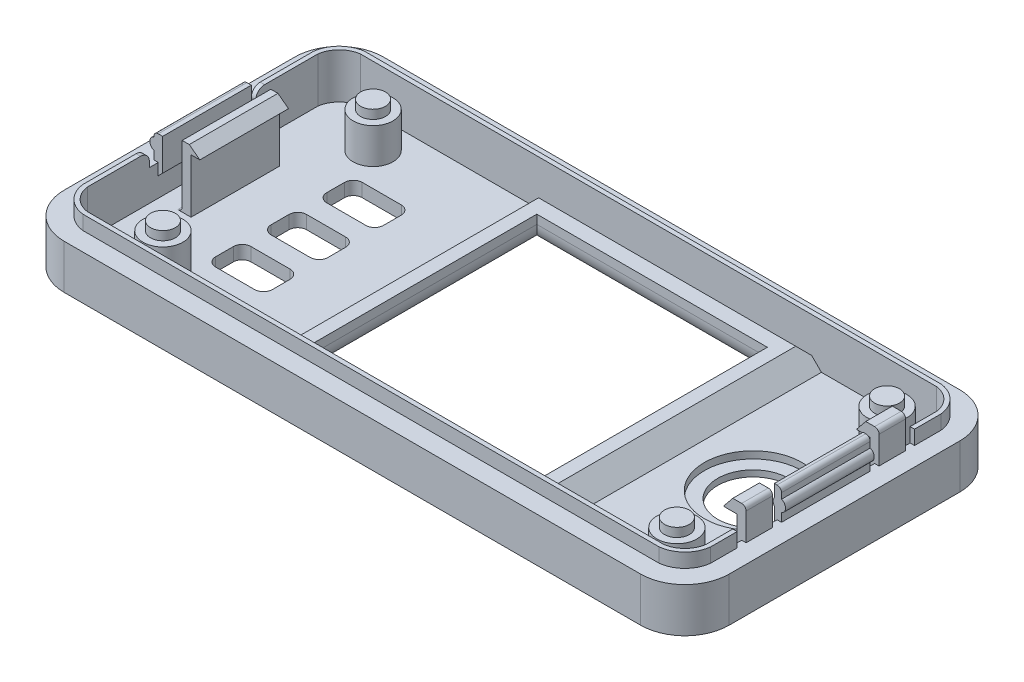
from build123d import *
from OCP.BRepFilletAPI import BRepFilletAPI_MakeChamfer

# Parameters (mm, degrees)
EXTRUDE_2_DEPTH          = 5
EXTRUDE_4_DEPTH          = 1.6
SKETCH_7_W               = 0.5
SKETCH_7_H               = 10
EXTRUDE_8_DEPTH          = 2.8
SKETCH_8_R               = 0.7
EXTRUDE_9_DEPTH          = 10
FILLET_1_R               = 0.5
SKETCH_11_W              = 1
SKETCH_11_H              = 1.6
CUT_EXTRUDE_1_DEPTH      = 1.2
FILLET_2_R               = 1
SKETCH_13_W              = 0.5
SKETCH_13_H              = 10
EXTRUDE_10_DEPTH         = 2.8
CUT_EXTRUDE_START        = -3.5
CUT_EXTRUDE_2_DEPTH      = 3.5
SKETCH_13_2_W            = 0.5
SKETCH_13_2_H            = 10
EXTRUDE_11_DEPTH         = 2
EXTRUDE_12_DEPTH         = 1.6
EXTRUDE_12_DEPTH_BACK    = 2
SKETCH_5_W               = 0.3
SKETCH_5_H               = 10
SKETCH_15_R              = 2.25
EXTRUDE_13_DEPTH         = 4
SKETCH_16_R              = 1.4
EXTRUDE_14_DEPTH         = 1
SKETCH_17_W              = 0.5
SKETCH_17_H              = 1
CUT_EXTRUDE_3_DEPTH      = 1.6
SKETCH_19_W              = 0.8
SKETCH_19_H              = 10
EXTRUDE_15_DEPTH         = 1.8
SKETCH_20_R              = 0.7
EXTRUDE_16_DEPTH         = 10
FILLET_4_R               = 0.5
SKETCH_21_W              = 0.5
SKETCH_21_H              = 3
EXTRUDE_17_DEPTH         = 2
SKETCH_22_W              = 3
SKETCH_22_H              = 6.3
EXTRUDE_23_DEPTH         = 0.5
FILLET_12_R              = 0.5
SKETCH_29_W              = 0.5
SKETCH_29_H              = 1
CUT_EXTRUDE_5_DEPTH      = 1.6
SKETCH_30_W              = 3
SKETCH_30_H              = 1.3
EXTRUDE_26_DEPTH         = 1.5
CHAMFER_7_SIZE           = 1
CHAMFER_7_SIZE2          = 1.234897157
SKETCH_24_W              = 1
SKETCH_24_H              = 10
EXTRUDE_27_DEPTH         = 7
FILLET_14_R              = 0.5
SKETCH_31_W              = 10
SKETCH_31_H              = 0.9
EXTRUDE_29_DEPTH         = 1
SKETCH_27_W              = 29
SKETCH_27_H              = 29
EXTRUDE_31_DEPTH         = 2
CHAMFER_8_SIZE           = 2
CUT_EXTRUDE_6_DEPTH      = 2
CUT_EXTRUDE_6_DEPTH_BACK = 1.5
SKETCH_26_W              = 26
SKETCH_26_H              = 25.6
CUT_EXTRUDE_7_DEPTH      = 1.5
SKETCH_33_R              = 5.5
CUT_EXTRUDE_8_DEPTH      = 0.8
SKETCH_34_R              = 4
CUT_EXTRUDE_9_DEPTH      = 0.8
CUT_EXTRUDE_START_2      = -0.5
CUT_EXTRUDE_11_DEPTH     = 0.5
FILLET_17_R              = 2.5
CHAMFER_9_SIZE           = 0.90426486
CHAMFER_9_SIZE_2         = 1.2
CHAMFER_10_SIZE          = 1.2
CHAMFER_START            = -9
CHAMFER_11_DEPTH         = 18
CHAMFER_START_2          = -5
CHAMFER_11_2_DEPTH       = 10


with BuildPart() as part:
    # case 2 → 凸台-拉伸2 (new body)
    with BuildSketch(Plane(origin=(0, 0, 0), x_dir=(1, 0, 0), z_dir=(0, 1, 0))):
        with BuildLine():
            Line((-34.042196447, 18), (30.957803553, 18))
            ThreePointArc((30.957803553, 18), (34.493337459, 16.535533906), (35.957803553, 13))
            Line((35.957803553, 13), (35.957803553, -13))
            ThreePointArc((35.957803553, -13), (34.493337459, -16.535533906), (30.957803553, -18))
            Line((30.957803553, -18), (-34.042196447, -18))
            ThreePointArc((-34.042196447, -18), (-37.577730353, -16.535533906), (-39.042196447, -13))
            Line((-39.042196447, -13), (-39.042196447, 13))
            ThreePointArc((-39.042196447, 13), (-37.577730353, 16.535533906), (-34.042196447, 18))
        make_face()
    extrude(amount=EXTRUDE_2_DEPTH)

    # 草图3 → 凸台-拉伸4 (add)
    with BuildSketch(Plane(origin=(0, 5, 0), x_dir=(1, 0, 0), z_dir=(0, 1, 0))):
        with BuildLine():
            Line((-36.942196447, 13), (-36.942196447, -13))
            ThreePointArc((-36.942196447, -13), (-35.997398295, -14.955201848), (-34.042196447, -15.9))
            Line((-34.042196447, -15.9), (30.957803553, -15.9))
            ThreePointArc((30.957803553, -15.9), (32.913005401, -14.955201848), (33.857803553, -13))
            Line((33.857803553, -13), (33.857803553, 13))
            ThreePointArc((33.857803553, 13), (32.913005401, 14.955201848), (30.957803553, 15.9))
            Line((30.957803553, 15.9), (-34.042196447, 15.9))
            ThreePointArc((-34.042196447, 15.9), (-35.997398295, 14.955201848), (-36.942196447, 13))
        make_face()
        with BuildLine():
            Line((-34.042196447, -15.4), (30.957803553, -15.4))
            ThreePointArc((30.957803553, -15.4), (32.562900965, -14.605097413), (33.357803553, -13))
            Line((33.357803553, -13), (33.357803553, 13))
            ThreePointArc((33.357803553, 13), (32.562900965, 14.605097413), (30.957803553, 15.4))
            Line((30.957803553, 15.4), (-34.042196447, 15.4))
            ThreePointArc((-34.042196447, 15.4), (-35.64729386, 14.605097413), (-36.442196447, 13))
            Line((-36.442196447, 13), (-36.442196447, -13))
            ThreePointArc((-36.442196447, -13), (-35.64729386, -14.605097413), (-34.042196447, -15.4))
        make_face(mode=Mode.SUBTRACT)
    extrude(amount=EXTRUDE_4_DEPTH)

    # 草图7 → 凸台-拉伸8 (add)
    with BuildSketch(Plane(origin=(0, 5, 0), x_dir=(1, 0, 0), z_dir=(0, 1, 0))):
        with Locations((-36.692196447, 0)):
            Rectangle(SKETCH_7_W, SKETCH_7_H)
    extrude(amount=EXTRUDE_8_DEPTH)

    # 草图8 → 凸台-拉伸9 (add)
    with BuildSketch(Plane.XY.offset(5)):
        with Locations((-36.692196447, 6.6)):
            Circle(SKETCH_8_R)
    extrude(amount=-EXTRUDE_9_DEPTH)

    # 圆角1
    fillet_1_edges = [part.edges().sort_by_distance(p)[0] for p in [
        (-36.942196447, 7.8, 0),
    ]]
    fillet(fillet_1_edges, radius=FILLET_1_R - 0.0001)  # a hair under: the kernel refuses the full size

    # 草图11 → 切除-拉伸1 (cut)
    with BuildSketch(Plane.ZY.offset(36.942196447)):
        with Locations((5.5, 5.8)):
            Rectangle(SKETCH_11_W, SKETCH_11_H)
        with Locations((-5.5, 5.8)):
            Rectangle(SKETCH_11_W, SKETCH_11_H)
    extrude(amount=-CUT_EXTRUDE_1_DEPTH, mode=Mode.SUBTRACT)

    # 圆角2
    fillet_2_edges = [part.edges().sort_by_distance(p)[0] for p in [
        (-36.692196447, 6.6, 6),
        (-36.692196447, 6.6, -6),
    ]]
    fillet(fillet_2_edges, radius=FILLET_2_R)

    # 草图13 → 凸台-拉伸10 (add)
    with BuildSketch(Plane(origin=(0, 5, 0), x_dir=(1, 0, 0), z_dir=(0, 1, 0))):
        with Locations((-36.192196447, 0)):
            Rectangle(SKETCH_13_W, SKETCH_13_H)
    extrude(amount=EXTRUDE_10_DEPTH)

    # 草图14 → 切除-拉伸2 (cut)
    with BuildSketch(Plane(origin=(0, 5, 0), x_dir=(1, 0, 0), z_dir=(0, 1, 0)).offset(CUT_EXTRUDE_START)):
        with BuildLine():
            Line((-34.042196447, -15.4), (30.957803553, -15.4))
            ThreePointArc((30.957803553, -15.4), (32.562900965, -14.605097413), (33.357803553, -13))
            Line((33.357803553, -13), (33.357803553, 13))
            ThreePointArc((33.357803553, 13), (32.562900965, 14.605097413), (30.957803553, 15.4))
            Line((30.957803553, 15.4), (-34.042196447, 15.4))
            ThreePointArc((-34.042196447, 15.4), (-35.64729386, 14.605097413), (-36.442196447, 13))
            Line((-36.442196447, 13), (-36.442196447, -13))
            ThreePointArc((-36.442196447, -13), (-35.64729386, -14.605097413), (-34.042196447, -15.4))
        make_face()
    extrude(amount=CUT_EXTRUDE_2_DEPTH, mode=Mode.SUBTRACT)

    # 草图13<2> → 凸台-拉伸11 (add)
    with BuildSketch(Plane(origin=(0, 5, 0), x_dir=(1, 0, 0), z_dir=(0, 1, 0))):
        with Locations((-36.192196447, 0)):
            Rectangle(SKETCH_13_2_W, SKETCH_13_2_H)
    extrude(amount=-EXTRUDE_11_DEPTH)

    # 草图5 → 凸台-拉伸12 (add, two sides: drawn at the far end of the back side and taken through both)
    with BuildSketch(Plane(origin=(0, 5, 0), x_dir=(1, 0, 0), z_dir=(0, 1, 0)).offset(-EXTRUDE_12_DEPTH_BACK)):
        with Locations((33.207803553, 0)):
            Rectangle(SKETCH_5_W, SKETCH_5_H)
    extrude(amount=EXTRUDE_12_DEPTH + EXTRUDE_12_DEPTH_BACK)

    # 草图15 → 凸台-拉伸13 (add)
    with BuildSketch(Plane(origin=(0, 1.5, 0), x_dir=(1, 0, 0), z_dir=(0, 1, 0))):
        with Locations(Location((28.957803553, -11.9, 0), (0, 0, 270))):
            Circle(SKETCH_15_R)
        with Locations(Location((-29.012994719, -11.9, 0), (0, 0, 270))):
            Circle(SKETCH_15_R)
        with Locations(Location((28.957803553, 11.8, 0), (0, 0, 270))):
            Circle(SKETCH_15_R)
        with Locations(Location((-29.012994719, 11.8, 0), (0, 0, 270))):
            Circle(SKETCH_15_R)
    extrude(amount=EXTRUDE_13_DEPTH)

    # 草图16 → 凸台-拉伸14 (add)
    with BuildSketch(Plane(origin=(0, 5.5, 0), x_dir=(1, 0, 0), z_dir=(0, 1, 0))):
        with Locations(Location((28.957803553, -11.9, 0), (0, 0, 270))):
            Circle(SKETCH_16_R)
        with Locations(Location((28.957803553, 11.8, 0), (0, 0, 270))):
            Circle(SKETCH_16_R)
        with Locations(Location((-29.012994719, -11.9, 0), (0, 0, 270))):
            Circle(SKETCH_16_R)
        with Locations(Location((-29.012994719, 11.8, 0), (0, 0, 270))):
            Circle(SKETCH_16_R)
    extrude(amount=EXTRUDE_14_DEPTH)

    # 草图17 → 切除-拉伸3 (cut)
    with BuildSketch(Plane(origin=(0, 6.6, 0), x_dir=(1, 0, 0), z_dir=(0, 1, 0))):
        with Locations((33.607803553, -5.5)):
            Rectangle(SKETCH_17_W, SKETCH_17_H)
        with Locations((33.607803553, 5.5)):
            Rectangle(SKETCH_17_W, SKETCH_17_H)
    extrude(amount=-CUT_EXTRUDE_3_DEPTH, mode=Mode.SUBTRACT)

    # 草图19 → 凸台-拉伸15 (add)
    with BuildSketch(Plane(origin=(0, 6.6, 0), x_dir=(1, 0, 0), z_dir=(0, 1, 0))):
        with Locations((33.457803553, 0)):
            Rectangle(SKETCH_19_W, SKETCH_19_H)
    extrude(amount=EXTRUDE_15_DEPTH)

    # 草图20 → 凸台-拉伸16 (add)
    with BuildSketch(Plane(origin=(0, 0, -5), x_dir=(-1, 0, 0), z_dir=(0, 0, -1))):
        with Locations((-33.607803553, 6.6)):
            Circle(SKETCH_20_R)
    extrude(amount=-EXTRUDE_16_DEPTH)

    # 圆角4
    fillet_4_edges = [part.edges().sort_by_distance(p)[0] for p in [
        (33.857803553, 8.4, 0),
    ]]
    fillet(fillet_4_edges, radius=FILLET_4_R)

    # 草图21 → 凸台-拉伸17 (add)
    with BuildSketch(Plane(origin=(0, 6.6, 0), x_dir=(1, 0, 0), z_dir=(0, 1, 0))):
        with Locations((33.607803553, -7.5)):
            Rectangle(SKETCH_21_W, SKETCH_21_H)
        with Locations((33.607803553, 7.5)):
            Rectangle(SKETCH_21_W, SKETCH_21_H)
    extrude(amount=EXTRUDE_17_DEPTH)

    # 草图22 → 凸台-拉伸23 (add)
    with BuildSketch(Plane.ZY.offset(-33.357803553)):
        with Locations((-7.5, 5.45)):
            Rectangle(SKETCH_22_W, SKETCH_22_H)
        with Locations((7.5, 5.45)):
            Rectangle(SKETCH_22_W, SKETCH_22_H)
    extrude(amount=EXTRUDE_23_DEPTH)

    # 圆角12
    fillet_12_edges = [part.edges().sort_by_distance(p)[0] for p in [
        (33.857803553, 8.6, 7.5),
        (33.857803553, 8.6, -7.5),
    ]]
    fillet(fillet_12_edges, radius=FILLET_12_R)

    # 草图29 → 切除-拉伸5 (cut)
    with BuildSketch(Plane(origin=(0, 6.6, 0), x_dir=(1, 0, 0), z_dir=(0, 1, 0))):
        with Locations((33.607803553, -9.5)):
            Rectangle(SKETCH_29_W, SKETCH_29_H)
        with Locations((33.607803553, 9.5)):
            Rectangle(SKETCH_29_W, SKETCH_29_H)
    extrude(amount=-CUT_EXTRUDE_5_DEPTH, mode=Mode.SUBTRACT)

    # 草图30 → 凸台-拉伸26 (add)
    with BuildSketch(Plane.ZY.offset(-32.857803553)):
        with Locations((7.5, 7.95)):
            Rectangle(SKETCH_30_W, SKETCH_30_H)
        with Locations((-7.5, 7.95)):
            Rectangle(SKETCH_30_W, SKETCH_30_H)
    extrude(amount=EXTRUDE_26_DEPTH)

    # 倒角7: one chamfer whose edges measure the first distance from different faces: ONE call of the kernel's chamfer builder (chamfer() names one face for all edges)
    chamfer_7_edges_1 = [part.edges().sort_by_distance(p)[0] for p in [
        (31.357803553, 8.6, 7.5),
    ]]
    chamfer_7_side_1 = [part.faces().sort_by_distance(p)[0] for p in [
        (32.357803553, 8.6, 7.5),
    ]]
    chamfer_7_edges_2 = [part.edges().sort_by_distance(p)[0] for p in [
        (31.357803553, 8.6, -7.5),
    ]]
    chamfer_7_side_2 = [part.faces().sort_by_distance(p)[0] for p in [
        (32.357803553, 8.6, -7.5),
    ]]
    chamfer_7 = BRepFilletAPI_MakeChamfer(part.part.solid().wrapped)
    for e in chamfer_7_edges_1:
        chamfer_7.Add(CHAMFER_7_SIZE, CHAMFER_7_SIZE2, e.wrapped, chamfer_7_side_1[0].wrapped)  # the first distance lies on this face
    for e in chamfer_7_edges_2:
        chamfer_7.Add(CHAMFER_7_SIZE, CHAMFER_7_SIZE2, e.wrapped, chamfer_7_side_2[0].wrapped)  # the first distance lies on this face
    add(Compound.cast(chamfer_7.Shape()), mode=Mode.REPLACE)

    # 草图24 → 凸台-拉伸27 (add)
    with BuildSketch(Plane(origin=(0, 1.5, 0), x_dir=(1, 0, 0), z_dir=(0, 1, 0))):
        with Locations((-33.242196447, 0)):
            Rectangle(SKETCH_24_W, SKETCH_24_H)
    extrude(amount=EXTRUDE_27_DEPTH)

    # 圆角14
    fillet_14_edges = [part.edges().sort_by_distance(p)[0] for p in [
        (-33.742196447, 1.5, 0),
    ]]
    fillet(fillet_14_edges, radius=FILLET_14_R)

    # 草图31 → 凸台-拉伸29 (add)
    with BuildSketch(Plane(origin=(-32.742196447, 0, 0), x_dir=(0, 0, -1), z_dir=(1, 0, 0))):
        with Locations((0, 8.05)):
            Rectangle(SKETCH_31_W, SKETCH_31_H)
    extrude(amount=EXTRUDE_29_DEPTH)

    # 草图27 → 凸台-拉伸31 (add)
    with BuildSketch(Plane(origin=(0, 1.5, 0), x_dir=(1, 0, 0), z_dir=(0, 1, 0))):
        with Locations((1.457803553, 0)):
            Rectangle(SKETCH_27_W, SKETCH_27_H)
    extrude(amount=EXTRUDE_31_DEPTH)

    # 倒角8
    # the kernel refuses this chamfer: 2 mm, written as the material it adds along each edge
    with BuildSketch(Plane(origin=(15.957803553, 1.5, -14.5), x_dir=(0, 0, -1), z_dir=(-1, 0, 0)), Plane(origin=(15.957803553, 1.5, 14.5), x_dir=(1, 0, 0), z_dir=(0, 0, -1)), Plane(origin=(-13.042196447, 1.5, 14.5), x_dir=(0, 0, 1), z_dir=(1, 0, 0)), Plane(origin=(-13.042196447, 1.5, -14.5), x_dir=(-1, 0, 0), z_dir=(0, 0, 1))) as chamfer_8_piece_1:
        Polygon((CHAMFER_8_SIZE, 0), (0, -CHAMFER_8_SIZE), (0, 0), align=None)
    extrude(amount=29)
    with BuildSketch(Plane(origin=(21.101169529, 1.5, -14.5), x_dir=(0, 0, -1), z_dir=(-1, 0, 0))) as chamfer_8_piece_2a_section:
        Polygon((CHAMFER_8_SIZE, 0), (0, -CHAMFER_8_SIZE), (0, 0), align=None)
    chamfer_8_piece_2a = extrude(amount=34.143365976, mode=Mode.PRIVATE)
    chamfer_8_piece_2a = split(chamfer_8_piece_2a, bisect_by=Plane(origin=(21.101169529, 1.5, -15.4), z_dir=(0, 0, 1)), keep=Keep.TOP, mode=Mode.PRIVATE)
    chamfer_8_piece_2a = split(chamfer_8_piece_2a, bisect_by=Plane(origin=(15.957803553, 1.5, -14.5), z_dir=(1, 0, 0)), keep=Keep.TOP, mode=Mode.PRIVATE)
    with BuildSketch(Plane(origin=(15.957803553, 1.5, 14.5), x_dir=(1, 0, 0), z_dir=(0, 0, -1))) as chamfer_8_piece_2b_section:
        Polygon((CHAMFER_8_SIZE, 0), (0, -CHAMFER_8_SIZE), (0, 0), align=None)
    chamfer_8_piece_2b = extrude(amount=34.143365976, mode=Mode.PRIVATE)
    chamfer_8_piece_2b = split(chamfer_8_piece_2b, bisect_by=Plane(origin=(15.957803553, 1.5, -15.4), z_dir=(0, 0, 1)), keep=Keep.TOP, mode=Mode.PRIVATE)
    chamfer_8_piece_2b = split(chamfer_8_piece_2b, bisect_by=Plane(origin=(15.957803553, 1.5, -14.5), z_dir=(0, 0, -1)), keep=Keep.TOP, mode=Mode.PRIVATE)
    chamfer_8_piece_2 = chamfer_8_piece_2a & chamfer_8_piece_2b
    add(chamfer_8_piece_2)
    with BuildSketch(Plane(origin=(15.957803553, 1.5, -14.5), x_dir=(0, 0, -1), z_dir=(-1, 0, 0))) as chamfer_8_piece_3a_section:
        Polygon((CHAMFER_8_SIZE, 0), (0, -CHAMFER_8_SIZE), (0, 0), align=None)
    chamfer_8_piece_3a = extrude(amount=34.143365976, mode=Mode.PRIVATE)
    chamfer_8_piece_3a = split(chamfer_8_piece_3a, bisect_by=Plane(origin=(15.957803553, 1.5, -15.4), z_dir=(0, 0, 1)), keep=Keep.TOP, mode=Mode.PRIVATE)
    chamfer_8_piece_3a = split(chamfer_8_piece_3a, bisect_by=Plane(origin=(-13.042196447, 1.5, -14.5), z_dir=(-1, 0, 0)), keep=Keep.TOP, mode=Mode.PRIVATE)
    with BuildSketch(Plane(origin=(-13.042196447, 1.5, -19.643365976), x_dir=(-1, 0, 0), z_dir=(0, 0, 1))) as chamfer_8_piece_3b_section:
        Polygon((CHAMFER_8_SIZE, 0), (0, -CHAMFER_8_SIZE), (0, 0), align=None)
    chamfer_8_piece_3b = extrude(amount=34.143365976, mode=Mode.PRIVATE)
    chamfer_8_piece_3b = split(chamfer_8_piece_3b, bisect_by=Plane(origin=(-13.042196447, 1.5, -15.4), z_dir=(0, 0, 1)), keep=Keep.TOP, mode=Mode.PRIVATE)
    chamfer_8_piece_3b = split(chamfer_8_piece_3b, bisect_by=Plane(origin=(-13.042196447, 1.5, -14.5), z_dir=(0, 0, -1)), keep=Keep.TOP, mode=Mode.PRIVATE)
    chamfer_8_piece_3 = chamfer_8_piece_3a & chamfer_8_piece_3b
    add(chamfer_8_piece_3)
    with BuildSketch(Plane(origin=(-13.042196447, 1.5, 14.5), x_dir=(0, 0, 1), z_dir=(1, 0, 0))) as chamfer_8_piece_4a_section:
        Polygon((CHAMFER_8_SIZE, 0), (0, -CHAMFER_8_SIZE), (0, 0), align=None)
    chamfer_8_piece_4a = extrude(amount=34.143365976, mode=Mode.PRIVATE)
    chamfer_8_piece_4a = split(chamfer_8_piece_4a, bisect_by=Plane(origin=(-13.042196447, 1.5, 15.4), z_dir=(0, 0, -1)), keep=Keep.TOP, mode=Mode.PRIVATE)
    chamfer_8_piece_4a = split(chamfer_8_piece_4a, bisect_by=Plane(origin=(15.957803553, 1.5, 14.5), z_dir=(1, 0, 0)), keep=Keep.TOP, mode=Mode.PRIVATE)
    with BuildSketch(Plane(origin=(15.957803553, 1.5, 19.643365976), x_dir=(1, 0, 0), z_dir=(0, 0, -1))) as chamfer_8_piece_4b_section:
        Polygon((CHAMFER_8_SIZE, 0), (0, -CHAMFER_8_SIZE), (0, 0), align=None)
    chamfer_8_piece_4b = extrude(amount=34.143365976, mode=Mode.PRIVATE)
    chamfer_8_piece_4b = split(chamfer_8_piece_4b, bisect_by=Plane(origin=(15.957803553, 1.5, 15.4), z_dir=(0, 0, -1)), keep=Keep.TOP, mode=Mode.PRIVATE)
    chamfer_8_piece_4b = split(chamfer_8_piece_4b, bisect_by=Plane(origin=(15.957803553, 1.5, 14.5), z_dir=(0, 0, 1)), keep=Keep.TOP, mode=Mode.PRIVATE)
    chamfer_8_piece_4 = chamfer_8_piece_4a & chamfer_8_piece_4b
    add(chamfer_8_piece_4)
    with BuildSketch(Plane(origin=(-13.042196447, 1.5, -14.5), x_dir=(-1, 0, 0), z_dir=(0, 0, 1))) as chamfer_8_piece_5a_section:
        Polygon((CHAMFER_8_SIZE, 0), (0, -CHAMFER_8_SIZE), (0, 0), align=None)
    chamfer_8_piece_5a = extrude(amount=34.143365976, mode=Mode.PRIVATE)
    chamfer_8_piece_5a = split(chamfer_8_piece_5a, bisect_by=Plane(origin=(-13.042196447, 1.5, 15.4), z_dir=(0, 0, -1)), keep=Keep.TOP, mode=Mode.PRIVATE)
    chamfer_8_piece_5a = split(chamfer_8_piece_5a, bisect_by=Plane(origin=(-13.042196447, 1.5, 14.5), z_dir=(0, 0, 1)), keep=Keep.TOP, mode=Mode.PRIVATE)
    with BuildSketch(Plane(origin=(-18.185562423, 1.5, 14.5), x_dir=(0, 0, 1), z_dir=(1, 0, 0))) as chamfer_8_piece_5b_section:
        Polygon((CHAMFER_8_SIZE, 0), (0, -CHAMFER_8_SIZE), (0, 0), align=None)
    chamfer_8_piece_5b = extrude(amount=34.143365976, mode=Mode.PRIVATE)
    chamfer_8_piece_5b = split(chamfer_8_piece_5b, bisect_by=Plane(origin=(-18.185562423, 1.5, 15.4), z_dir=(0, 0, -1)), keep=Keep.TOP, mode=Mode.PRIVATE)
    chamfer_8_piece_5b = split(chamfer_8_piece_5b, bisect_by=Plane(origin=(-13.042196447, 1.5, 14.5), z_dir=(-1, 0, 0)), keep=Keep.TOP, mode=Mode.PRIVATE)
    chamfer_8_piece_5 = chamfer_8_piece_5a & chamfer_8_piece_5b
    add(chamfer_8_piece_5)

    # 草图26 → 切除-拉伸6 (cut, two sides: drawn at the far end of the back side and taken through both)
    with BuildSketch(Plane(origin=(0, 1.5, 0), x_dir=(1, 0, 0), z_dir=(0, 1, 0)).offset(-CUT_EXTRUDE_6_DEPTH_BACK)):
        with Locations((1.457803553, 0)):
            Rectangle(SKETCH_26_W, SKETCH_26_H)
    extrude(amount=CUT_EXTRUDE_6_DEPTH + CUT_EXTRUDE_6_DEPTH_BACK, mode=Mode.SUBTRACT)

    # 草图32 → 切除-拉伸7 (cut)
    with BuildSketch(Plane.XZ):
        with BuildLine():
            Line((-26.492196447, 8.48), (-22.092196447, 8.48))
            ThreePointArc((-22.092196447, 8.48), (-21.385089666, 8.187106781), (-21.092196447, 7.48))
            Line((-21.092196447, 7.48), (-21.092196447, 5.48))
            ThreePointArc((-21.092196447, 5.48), (-21.385089666, 4.772893219), (-22.092196447, 4.48))
            Line((-22.092196447, 4.48), (-26.492196447, 4.48))
            ThreePointArc((-26.492196447, 4.48), (-27.199303228, 4.772893219), (-27.492196447, 5.48))
            Line((-27.492196447, 5.48), (-27.492196447, 7.48))
            ThreePointArc((-27.492196447, 7.48), (-27.199303228, 8.187106781), (-26.492196447, 8.48))
        make_face()
        with BuildLine():
            Line((-26.492196447, 2.21), (-22.092196447, 2.21))
            ThreePointArc((-22.092196447, 2.21), (-21.385089666, 1.917106781), (-21.092196447, 1.21))
            Line((-21.092196447, 1.21), (-21.092196447, -0.79))
            ThreePointArc((-21.092196447, -0.79), (-21.385089666, -1.497106781), (-22.092196447, -1.79))
            Line((-22.092196447, -1.79), (-26.492196447, -1.79))
            ThreePointArc((-26.492196447, -1.79), (-27.199303228, -1.497106781), (-27.492196447, -0.79))
            Line((-27.492196447, -0.79), (-27.492196447, 1.21))
            ThreePointArc((-27.492196447, 1.21), (-27.199303228, 1.917106781), (-26.492196447, 2.21))
        make_face()
        with BuildLine():
            Line((-26.492196447, -4.06), (-22.092196447, -4.06))
            ThreePointArc((-22.092196447, -4.06), (-21.385089666, -4.352893219), (-21.092196447, -5.06))
            Line((-21.092196447, -5.06), (-21.092196447, -7.06))
            ThreePointArc((-21.092196447, -7.06), (-21.385089666, -7.767106781), (-22.092196447, -8.06))
            Line((-22.092196447, -8.06), (-26.492196447, -8.06))
            ThreePointArc((-26.492196447, -8.06), (-27.199303228, -7.767106781), (-27.492196447, -7.06))
            Line((-27.492196447, -7.06), (-27.492196447, -5.06))
            ThreePointArc((-27.492196447, -5.06), (-27.199303228, -4.352893219), (-26.492196447, -4.06))
        make_face()
    extrude(amount=-CUT_EXTRUDE_7_DEPTH, mode=Mode.SUBTRACT)

    # 草图33 → 切除-拉伸8 (cut)
    with BuildSketch(Plane(origin=(0, 1.5, 0), x_dir=(1, 0, 0), z_dir=(0, 1, 0))):
        with Locations(Location((25.657803553, 0, 0), (0, 0, 270))):
            Circle(SKETCH_33_R)
    extrude(amount=-CUT_EXTRUDE_8_DEPTH, mode=Mode.SUBTRACT)

    # 草图34 → 切除-拉伸9 (cut)
    with BuildSketch(Plane(origin=(0, 0.7, 0), x_dir=(1, 0, 0), z_dir=(0, 1, 0))):
        with Locations(Location((25.657803553, 0, 0), (0, 0, 270))):
            Circle(SKETCH_34_R)
    extrude(amount=-CUT_EXTRUDE_9_DEPTH, mode=Mode.SUBTRACT)

    # 切除-拉伸11: read off the stored shape, not the designer's step
    # 切除-拉伸11 outline → 切除-拉伸11 (cut)
    with BuildSketch(Plane.XZ.offset(CUT_EXTRUDE_START_2)):
        with BuildLine():
            Line((-33.234161348, -14.51479109), (-32.946609498, -14.682541858))
            add(Edge.make_bspline(
                [(-32.946609498, -14.682541858), (-32.852733423, -14.734452816), (-32.748911507, -14.762413309), (-32.541218919, -14.762413309), (-32.437372625, -14.734452816), (-32.343520928, -14.682541858)],
                knots=[3, 3, 3, 3, 4, 4, 5, 5, 5, 5], degree=3))
            Line((-32.343520928, -14.682541858), (-32.055944701, -14.51479109))
            Line((-32.055944701, -14.51479109), (-30.564214631, -13.654097894))
            Line((-30.564214631, -13.654097894), (-30.276638404, -13.488346046))
            add(Edge.make_bspline(
                [(-30.276638404, -13.488346046), (-30.090933928, -13.380514102), (-29.975094119, -13.180817192), (-29.975094119, -12.967140035)],
                knots=[8, 8, 8, 8, 9, 9, 9, 9], degree=3))
            Line((-29.975094119, -12.967140035), (-29.975094119, -10.578760599))
            add(Edge.make_bspline(
                [(-29.975094119, -10.578760599), (-29.975094119, -10.363096712), (-30.090933928, -10.165386532), (-30.276638404, -10.057554588)],
                knots=[10, 10, 10, 10, 11, 11, 11, 11], degree=3))
            Line((-30.276638404, -10.057554588), (-30.564214631, -9.89180274))
            Line((-30.564214631, -9.89180274), (-32.055944701, -9.031109544))
            Line((-32.055944701, -9.031109544), (-32.343520928, -8.863370964))
            add(Edge.make_bspline(
                [(-32.343520928, -8.863370964), (-32.437372625, -8.809448898), (-32.541218919, -8.783487325), (-32.748911507, -8.783487325), (-32.852733423, -8.809448898), (-32.946609498, -8.863370964)],
                knots=[14, 14, 14, 14, 15, 15, 16, 16, 16, 16], degree=3))
            Line((-32.946609498, -8.863370964), (-33.234161348, -9.031109544))
            Line((-33.234161348, -9.031109544), (-34.725891418, -9.89180274))
            Line((-34.725891418, -9.89180274), (-35.013443268, -10.057554588))
            add(Edge.make_bspline(
                [(-35.013443268, -10.057554588), (-35.201171039, -10.165386532), (-35.314987552, -10.363096712), (-35.314987552, -10.578760599)],
                knots=[19, 19, 19, 19, 20, 20, 20, 20], degree=3))
            Line((-35.314987552, -10.578760599), (-35.314987552, -12.967140035))
            add(Edge.make_bspline(
                [(-35.314987552, -12.967140035), (-35.314987552, -13.180817192), (-35.201171039, -13.380514102), (-35.013443268, -13.488346046)],
                knots=[21, 21, 21, 21, 22, 22, 22, 22], degree=3))
            Line((-35.013443268, -13.488346046), (-34.725891418, -13.654097894))
            Line((-34.725891418, -13.654097894), (-33.234161348, -14.51479109))
        make_face()
        with BuildLine():
            add(Edge.make_bspline(
                [(-32.451340683, -11.93670934), (-32.571153954, -11.866808109), (-32.720926637, -11.866808109), (-32.840764285, -11.93670934)],
                knots=[7, 7, 7, 7, 8, 8, 8, 8], degree=3))
            add(Edge.make_bspline(
                [(-30.642099351, -12.981120281), (-30.64609719, -12.979121362), (-32.451340683, -11.93670934)],
                knots=[0, 0, 0, 1, 1, 1], degree=2))
            add(Edge.make_bspline(
                [(-30.660065248, -13.250706235), (-30.558217873, -13.192798519), (-30.548247654, -13.049010405), (-30.642099351, -12.981120281)],
                knots=[1, 1, 1, 1, 2, 2, 2, 2], degree=3))
            Line((-30.660065248, -13.250706235), (-32.505262749, -14.317093099))
            add(Edge.make_bspline(
                [(-32.786842219, -14.317093099), (-32.698987279, -14.367017327), (-32.591143147, -14.367017327), (-32.505262749, -14.317093099)],
                knots=[3, 3, 3, 3, 4, 4, 4, 4], degree=3))
            Line((-32.786842219, -14.317093099), (-34.622045124, -13.248707316))
            add(Edge.make_bspline(
                [(-34.624044043, -13.003084016), (-34.717895741, -13.059005002), (-34.715896821, -13.194797438), (-34.622045124, -13.248707316)],
                knots=[5, 5, 5, 5, 6, 6, 6, 6], degree=3))
            Line((-34.624044043, -13.003084016), (-32.840764285, -11.93670934))
        make_face(mode=Mode.SUBTRACT)
        with BuildLine():
            add(Edge.make_bspline(
                [(-34.552156081, -11.784937738), (-34.396411017, -11.69707061), (-34.286567966, -11.53731552), (-34.286567966, -11.395526325), (-34.286567966, -11.25773497), (-34.396411017, -11.219792069), (-34.552156081, -11.309658117)],
                knots=[0, 0, 0, 0, 1, 1, 1, 2, 2, 2, 2], degree=3))
            add(Edge.make_bspline(
                [(-34.552156081, -11.309658117), (-34.705926602, -11.395526325), (-34.815745276, -11.557280335), (-34.815745276, -11.695071691), (-34.815745276, -11.834861966), (-34.705926602, -11.872804867), (-34.552156081, -11.784937738)],
                knots=[2, 2, 2, 2, 3, 3, 3, 4, 4, 4, 4], degree=3))
        make_face(mode=Mode.SUBTRACT)
        with BuildLine():
            add(Edge.make_bspline(
                [(-34.76182321, -10.25325366), (-34.773816726, -10.259250418), (-34.781812403, -10.273230664), (-34.781812403, -10.287210911)],
                knots=[0, 0, 0, 0, 1, 1, 1, 1], degree=3))
            Line((-34.76182321, -10.25325366), (-34.378420744, -10.035590853))
            add(Edge.make_bspline(
                [(-34.320500839, -10.069535915), (-34.320500839, -10.039588692), (-34.35245917, -10.021610607), (-34.378420744, -10.035590853)],
                knots=[2, 2, 2, 2, 3, 3, 3, 3], degree=3))
            Line((-34.320500839, -10.069535915), (-34.320500839, -10.950206116))
            add(Edge.make_bspline(
                [(-34.340490032, -10.984151178), (-34.328496516, -10.976167689), (-34.320500839, -10.964174173), (-34.320500839, -10.950206116)],
                knots=[4, 4, 4, 4, 5, 5, 5, 5], degree=3))
            Line((-34.340490032, -10.984151178), (-34.723892498, -11.199827254))
            add(Edge.make_bspline(
                [(-34.781812403, -11.165870003), (-34.781812403, -11.195829415), (-34.749854072, -11.213795311), (-34.723892498, -11.199827254)],
                knots=[6, 6, 6, 6, 7, 7, 7, 7], degree=3))
            Line((-34.781812403, -11.165870003), (-34.781812403, -10.287210911))
        make_face(mode=Mode.SUBTRACT)
        with BuildLine():
            add(Edge.make_bspline(
                [(-33.369941596, -10.484908902), (-33.597623376, -10.61271785), (-33.705443131, -10.780456429), (-33.705443131, -11.165870003), (-33.581632022, -11.163871084), (-33.357972457, -11.036074324)],
                knots=[0, 0, 0, 0, 1, 1, 2.031545133, 2.031545133, 2.031545133, 2.031545133], degree=3))
            Line((-33.357972457, -11.036074324), (-33.186236039, -10.940211519))
            add(Edge.make_bspline(
                [(-33.166246847, -10.906266457), (-33.166246847, -10.920246704), (-33.174242524, -10.93422695), (-33.186236039, -10.940211519)],
                knots=[4, 4, 4, 4, 5, 5, 5, 5], degree=3))
            Line((-33.166246847, -10.906266457), (-33.166246847, -9.380579137))
            add(Edge.make_bspline(
                [(-33.146306408, -9.346634075), (-33.160274466, -9.354617563), (-33.166246847, -9.36659889), (-33.166246847, -9.380579137)],
                knots=[3, 3, 3, 3, 4, 4, 4, 4], degree=3))
            Line((-33.146306408, -9.346634075), (-32.758881726, -9.126972349))
            add(Edge.make_bspline(
                [(-32.700961821, -9.160917411), (-32.700961821, -9.130957999), (-32.732920152, -9.112992102), (-32.758881726, -9.126972349)],
                knots=[5, 5, 5, 5, 6, 6, 6, 6], degree=3))
            Line((-32.700961821, -9.160917411), (-32.700961821, -11.010112751))
            add(Edge.make_bspline(
                [(-32.720926637, -11.044057813), (-32.706958579, -11.038073244), (-32.700961821, -11.024092997), (-32.700961821, -11.010112751)],
                knots=[7, 7, 7, 7, 8, 8, 8, 8], degree=3))
            Line((-32.720926637, -11.044057813), (-33.379936192, -11.41749006))
            add(Edge.make_bspline(
                [(-33.379936192, -11.41749006), (-33.807290505, -11.65912771), (-34.16073356, -11.707053018), (-34.16073356, -10.766476182), (-33.803292667, -10.361097792), (-33.393928627, -10.129442551)],
                knots=[9, 9, 9, 9, 10, 10, 10.962489192, 10.962489192, 10.962489192, 10.962489192], degree=3))
            Line((-33.393928627, -10.129442551), (-33.186236039, -10.013627118))
            Line((-33.186236039, -10.013627118), (-33.186236039, -10.393043935))
            Line((-33.186236039, -10.393043935), (-33.369941596, -10.484908902))
        make_face(mode=Mode.SUBTRACT)
    extrude(amount=CUT_EXTRUDE_11_DEPTH, mode=Mode.SUBTRACT)

    # 圆角17
    fillet_17_edges = [part.edges().sort_by_distance(p)[0] for p in [
        (-11.542196447, 0, 0),
        (1.457803553, 0, 12.8),
        (14.457803553, 0, 0),
        (1.457803553, 0, -12.8),
    ]]
    fillet(fillet_17_edges, radius=FILLET_17_R)

    # 倒角9
    # the kernel refuses this chamfer: 1.2, 0.90426486 mm, written as the material it takes off along each edge
    with BuildSketch(Plane(origin=(-31.742196447, 8.5, 8.096678473), x_dir=(0, -1, 0), z_dir=(0, 0, -1))) as chamfer_9_piece_1:
        Polygon((CHAMFER_9_SIZE, 0), (0, CHAMFER_9_SIZE_2), (0, 0), align=None)
    extrude(amount=16.193356947, mode=Mode.SUBTRACT)

    # 倒角10
    # the kernel refuses this chamfer: 1.2 mm, written as the material it takes off along each edge
    with BuildSketch(Plane(origin=(-35.942196447, 3, 8.086019586), x_dir=(-1, 0, 0), z_dir=(0, 0, -1))) as chamfer_10_piece_1_section:
        Polygon((CHAMFER_10_SIZE, 0), (0, CHAMFER_10_SIZE), (0, 0), align=None)
    chamfer_10_piece_1 = extrude(amount=16.172039171, mode=Mode.PRIVATE)
    chamfer_10_piece_1 = split(chamfer_10_piece_1, bisect_by=Plane(origin=(-36.442196447, 3, 8.086019586), z_dir=(1, 0, 0)), keep=Keep.TOP, mode=Mode.PRIVATE)
    add(chamfer_10_piece_1, mode=Mode.SUBTRACT)

    # 倒角11: read off the stored shape, not the designer's step
    # 倒角11 outline → 倒角11 (cut)
    with BuildSketch(Plane.XY.offset(CHAMFER_START)):
        Polygon((33.357803553, 3), (32.857803553, 3.5), (32.857803553, 2.3), (33.357803553, 2.3), align=None)
    extrude(amount=CHAMFER_11_DEPTH, mode=Mode.SUBTRACT)

    # Chamfer 11 2 outline → Chamfer 11 2 (cut)
    with BuildSketch(Plane.XY.offset(CHAMFER_START_2)):
        Polygon((33.357803553, 3), (33.357803553, 3.9), (33.057803553, 4.2), (33.057803553, 3.3), align=None)
    extrude(amount=CHAMFER_11_2_DEPTH, mode=Mode.SUBTRACT)


solid = part.part
